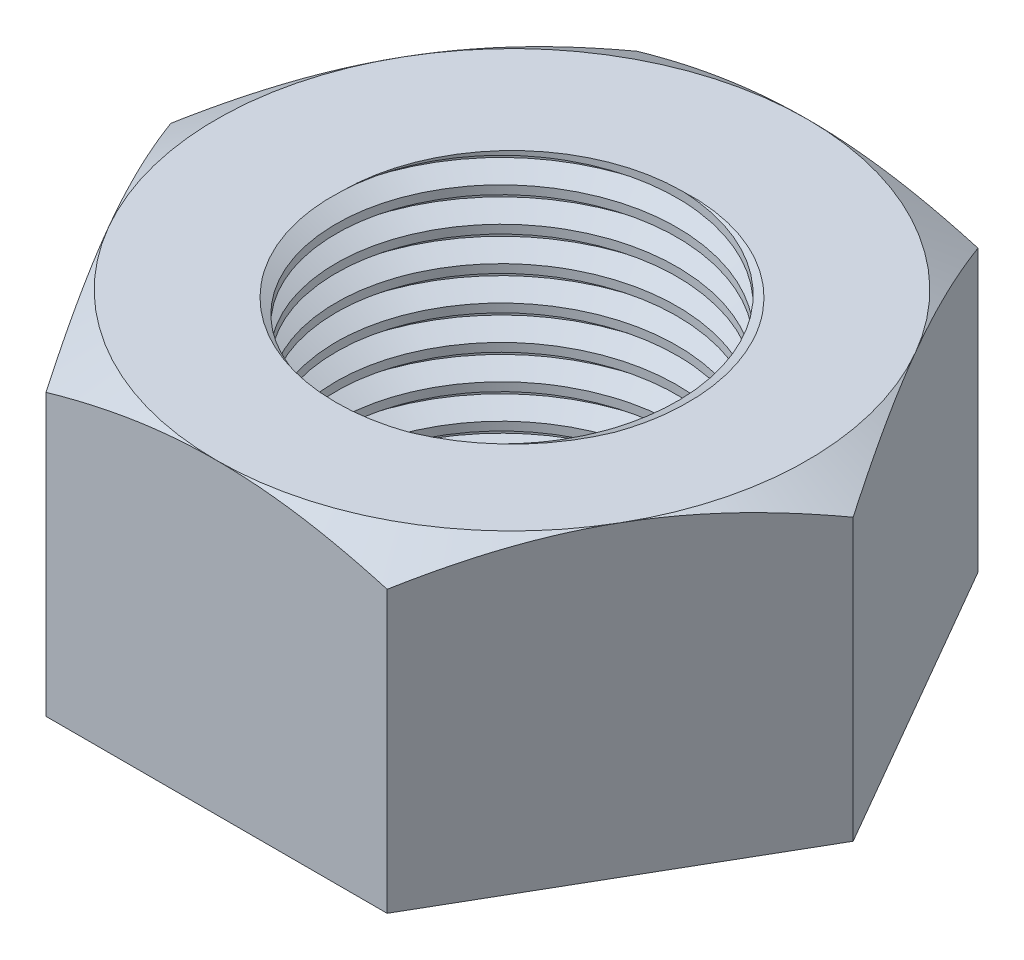
from build123d import *

# Parameters (mm, degrees)
BOSS_EXTRUDE1_DEPTH     = 18
CUT_EXTRUDE1_DEPTH      = 33
CUT_EXTRUDE1_DEPTH_BACK = 33
SKETCH3_R               = 10
THREAD1_PITCH           = 2


with BuildPart() as part:
    # Sketch1 → Boss-Extrude1 (new body)
    with BuildSketch(Plane(origin=(0, 0, 0), x_dir=(1, 0, 0), z_dir=(0, 1, 0))):
        Polygon((10, -17.320508076), (20, 0), (10, 17.320508076), (-10, 17.320508076), (-20, 0), (-10, -17.320508076), align=None)
    extrude(amount=BOSS_EXTRUDE1_DEPTH)

    # Sketch2 → Cut-Revolve1 (revolve, cut)
    with BuildSketch(Plane(origin=(0, 0, 0), x_dir=(0, 0, -1), z_dir=(1, 0, 0))):
        Polygon((17.320508076, 18), (20.784609691, 18), (20.784609691, 16), align=None)
    revolve(axis=Axis((0, 0, 0), (0, -1, 0)), mode=Mode.SUBTRACT)

    # Sketch3 → Cut-Extrude1 (cut, two sides: drawn at the far end of the back side and taken through both)
    with BuildSketch(Plane(origin=(0, 18, 0), x_dir=(1, 0, 0), z_dir=(0, 1, 0)).offset(-CUT_EXTRUDE1_DEPTH_BACK)):
        with Locations(Location((0, 0, 0), (0, 0, 270))):
            Circle(SKETCH3_R)
    extrude(amount=CUT_EXTRUDE1_DEPTH + CUT_EXTRUDE1_DEPTH_BACK, mode=Mode.SUBTRACT)

    # Thread1: the profile of Thread Profile1 profile screwed along a right-hand helix of 11 turns, 10 arcs to a turn; built about Z, then put on its axis
    thread1_z = Axis((0, 0, 0), (0, 0, 1))
    thread1_corners = [(9.9997, 0, -0.000173205), (11.08253175, 0, 0.624999997), (11.08253175, 0, 0.874999997), (9.9997, 0, 1.5001732)]
    with BuildLine(mode=Mode.PRIVATE) as thread1_profile:
        Line(thread1_corners[0], thread1_corners[1])
        Line(thread1_corners[1], thread1_corners[2])
        Line(thread1_corners[2], thread1_corners[3])
        Line(thread1_corners[3], thread1_corners[0])
    thread1_cap = Face(thread1_profile.wire())
    thread1_turn_angles = [0, 18, 36, 54, 72, 90, 108, 126, 144, 162, 180, 198, 216, 234, 252, 270, 288, 306, 324, 342, 360]
    thread1_turn_weights = [1, 0.9510565162951535, 1, 0.9510565162951535, 1, 0.9510565162951535, 1, 0.9510565162951535, 1, 0.9510565162951535, 1, 0.9510565162951535, 1, 0.9510565162951535, 1, 0.9510565162951535, 1, 0.9510565162951535, 1, 0.9510565162951535, 1]
    thread1_turn_rails = [Edge.make_bspline([Vector(p[0], p[1], 0).rotate(thread1_z, thread1_turn_angles[k]) / thread1_turn_weights[k] + Vector(0, 0, p[2] + THREAD1_PITCH * thread1_turn_angles[k] / 360) for k in range(21)], [0, 0, 0, 1, 1, 2, 2, 3, 3, 4, 4, 5, 5, 6, 6, 7, 7, 8, 8, 9, 9, 10, 10, 10], 2, thread1_turn_weights) for p in thread1_corners]
    thread1_turn_sides = [Face.make_surface_from_curves(thread1_turn_rails[p[0]], thread1_turn_rails[p[1]]) for p in [(0, 1), (1, 2), (2, 3), (3, 0)]]
    thread1 = Plane(origin=(0, 22, 0), x_dir=(-1, 0, 0), z_dir=(0, -1, 0)) * Solid(Shell([*[p.moved(Location((0, 0, THREAD1_PITCH * i))) for i in range(11) for p in thread1_turn_sides], thread1_cap, thread1_cap.rotate(thread1_z, 3960).moved(Location((0, 0, THREAD1_PITCH * 3960 / 360)))]))
    add(thread1, mode=Mode.SUBTRACT)


solid = part.part
